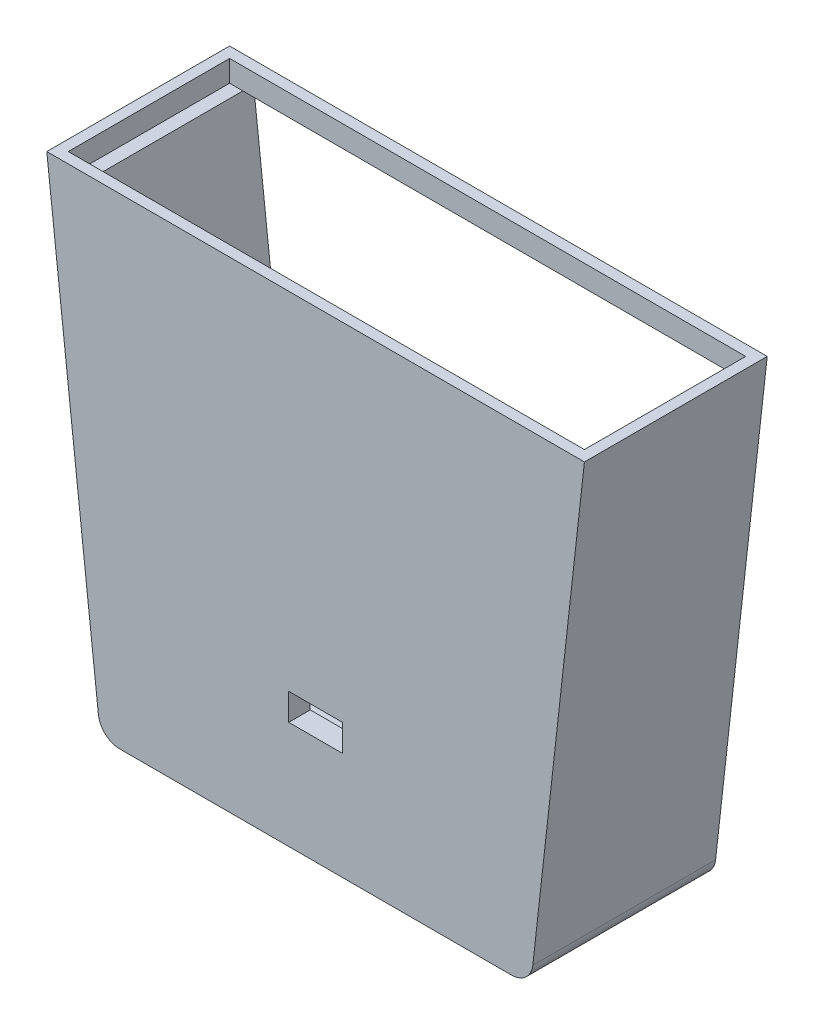
from build123d import *

# Parameters (mm, degrees)
SKETCH1_W           = 12.7
SKETCH1_H           = 6.35
BOSS_EXTRUDE1_DEPTH = 5.08
BOSS_EXTRUDE2_DEPTH = 38.1
SKETCH4_W           = 121.92
SKETCH4_H           = 38.1
CUT_EXTRUDE1_DEPTH  = 5.08
BOSS_EXTRUDE3_DEPTH = 2.54
SKETCH7_R           = 1.905
CUT_EXTRUDE2_DEPTH  = 2.54
BOSS_EXTRUDE4_DEPTH = 9.017
CUT_EXTRUDE6_DEPTH  = 6.477


with BuildPart() as part:
    # Sketch1 → Boss-Extrude1 (new body)
    with BuildSketch(Plane.XY):
        with BuildLine():
            Line((63.5, 56.7961272), (-63.5, 56.7961272))
            Line((-63.5, 56.7961272), (-51.304854459, -52.280570501))
            ThreePointArc((-51.304854459, -52.280570501), (-49.642976536, -55.502534499), (-46.25630987, -56.796126057))
            Line((-46.25630987, -56.796126057), (46.25630987, -56.796126057))
            ThreePointArc((46.25630987, -56.796126057), (49.642976536, -55.502534499), (51.304854459, -52.280570501))
            Line((51.304854459, -52.280570501), (63.5, 56.7961272))
        make_face()
        with Locations((0, -28.221126057)):
            Rectangle(SKETCH1_W, SKETCH1_H, mode=Mode.SUBTRACT)
    extrude(amount=-BOSS_EXTRUDE1_DEPTH)

    # Sketch2 → Boss-Extrude2 (add)
    with BuildSketch(Plane.XY.offset(-5.08)):
        with BuildLine():
            Line((63.5, 56.7961272), (-63.5, 56.7961272))
            Line((-63.5, 56.7961272), (-51.304854459, -52.280570501))
            ThreePointArc((-51.304854459, -52.280570501), (-49.642976536, -55.502534499), (-46.25630987, -56.796126057))
            Line((-46.25630987, -56.796126057), (46.25630987, -56.796126057))
            ThreePointArc((46.25630987, -56.796126057), (49.642976536, -55.502534499), (51.304854459, -52.280570501))
            Line((51.304854459, -52.280570501), (63.5, 56.7961272))
        make_face()
        with BuildLine():
            Line((41.712619739, -51.716126057), (-41.712619739, -51.716126057))
            ThreePointArc((-41.712619739, -51.716126057), (-45.099286406, -50.422534499), (-46.761164329, -47.200570501))
            Line((-46.761164329, -47.200570501), (-57.820387337, 51.7161272))
            Line((-57.820387337, 51.7161272), (57.820387337, 51.7161272))
            Line((57.820387337, 51.7161272), (46.761164329, -47.200570501))
            ThreePointArc((46.761164329, -47.200570501), (45.099286406, -50.422534499), (41.712619739, -51.716126057))
        make_face(mode=Mode.SUBTRACT)
    extrude(amount=-BOSS_EXTRUDE2_DEPTH)

    # Sketch4 → Cut-Extrude1 (cut)
    with BuildSketch(Plane(origin=(0, 56.7961272, -56.7961272), x_dir=(1, 0, 0), z_dir=(0, -1, 0))):
        with Locations((0, 35.2061272)):
            Rectangle(SKETCH4_W, SKETCH4_H)
    extrude(amount=CUT_EXTRUDE1_DEPTH, mode=Mode.SUBTRACT)

    # Sketch6 → Boss-Extrude3 (add)
    with BuildSketch(Plane.XY.offset(-43.18)):
        Polygon((-52.99583525, 8.564021488), (-33.94583525, 8.564021488), (-33.94583525, -4.135978512), (-51.575932084, -4.135978512), align=None)
        Polygon((33.94583525, -4.135978512), (51.575932084, -4.135978512), (52.99583525, 8.564021488), (33.94583525, 8.564021488), align=None)
    extrude(amount=BOSS_EXTRUDE3_DEPTH)

    # Sketch7 → Cut-Extrude2 (cut)
    with BuildSketch(Plane.XY.offset(-43.18)):
        with Locations((-43.115859459, 2.214021488)):
            Circle(SKETCH7_R)
        with Locations((43.115859459, 2.214021488)):
            Circle(SKETCH7_R)
    extrude(amount=CUT_EXTRUDE2_DEPTH, mode=Mode.SUBTRACT)

    # Sketch8 → Boss-Extrude4 (add)
    with BuildSketch(Plane(origin=(0, 0, -5.08), x_dir=(-1, 0, 0), z_dir=(0, 0, -1))):
        Polygon((-25.08504, 41.5561272), (-25.08504, -20.9786728), (25.08504, -20.9786728), align=None)
    extrude(amount=BOSS_EXTRUDE4_DEPTH)

    # Sketch12 → Cut-Extrude6 (cut)
    with BuildSketch(Plane(origin=(0, 0, -11.557), x_dir=(-1, 0, 0), z_dir=(0, 0, -1))):
        Polygon((-22.54504, -18.4386728), (23.047262583, -18.4386728), (-22.54504, 38.39012882), align=None)
    extrude(amount=-CUT_EXTRUDE6_DEPTH, mode=Mode.SUBTRACT)


solid = part.part
